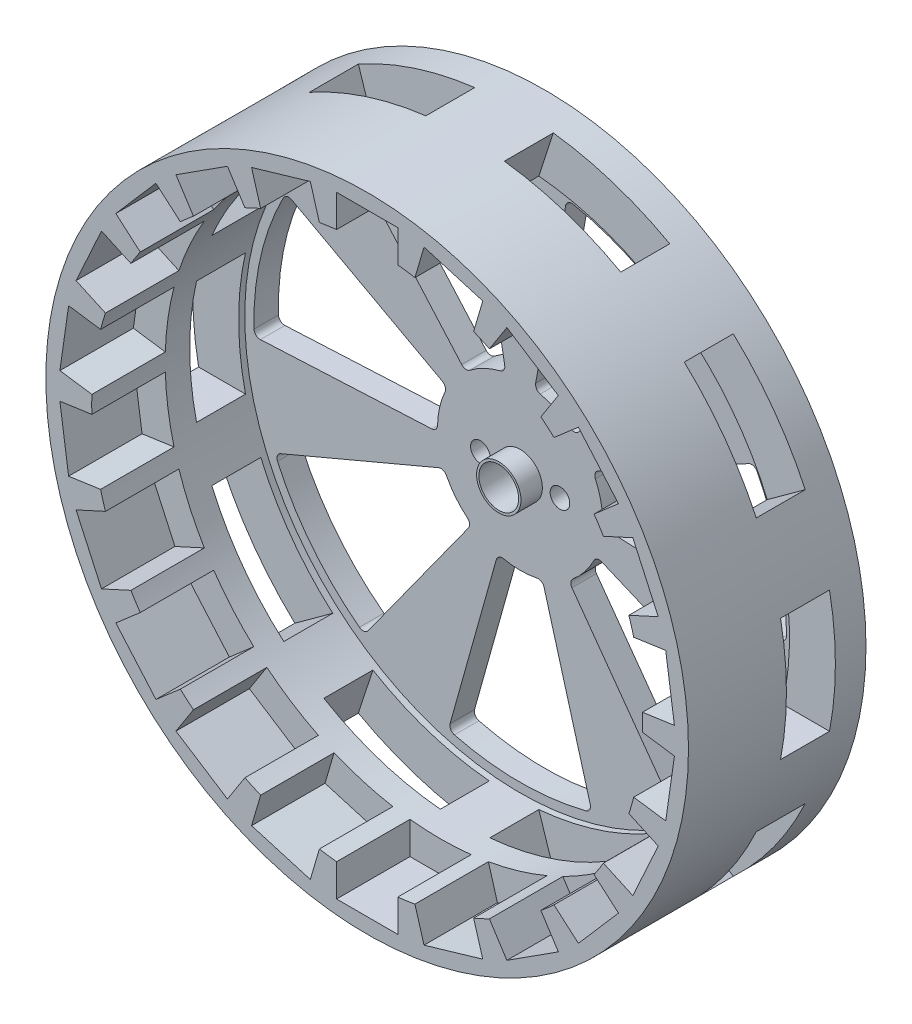
from build123d import *
from build123d.topology import SkipClean

# Parameters (mm, degrees)
SKETCH_1_R                       = 52.5
SKETCH_1_R_2                     = 45
EXTRUDE_1_DEPTH                  = 25
EXTRUDE_START                    = -4
SKETCH_1_2_R                     = 52.5
EXTRUDE_2_DEPTH                  = 4
SKETCH_2_R                       = 3.25
SKETCH_2_R_2                     = 1.6
CUT_EXTRUDE_1_DEPTH              = 4
SKETCH_3_R                       = 3.625
SKETCH_3_R_2                     = 3.25
EXTRUDE_3_DEPTH                  = 3.5
SKETCH_5_W                       = 10
SKETCH_5_H                       = 10
CUT_EXTRUDE_4_DEPTH              = 12
PATTERN_CIRCULAR_2_COUNT         = 22
SKETCH_7_W                       = 8
SKETCH_7_H                       = 20
CUT_EXTRUDE_5_DEPTH              = 10
PATTERN_CIRCULAR_3_COUNT         = 10
CUT_EXTRUDE_6_DEPTH              = 10
FILLET_1_R                       = 1
PATTERN_CIRCULAR_4_COUNT         = 7
FILLET_1_OF_PATTERN_CIRCULAR_4_R = 1


with BuildPart() as part:
    # ｽｹｯﾁ1 → ﾎﾞｽ - 押し出し1 (new body)
    with BuildSketch(Plane.XY):
        Circle(SKETCH_1_R)
        Circle(SKETCH_1_R_2, mode=Mode.SUBTRACT)
    extrude(amount=EXTRUDE_1_DEPTH)

    # ｽｹｯﾁ1<2> → ﾎﾞｽ - 押し出し2 (add)
    with BuildSketch(Plane.XY.offset(EXTRUDE_START)):
        Circle(SKETCH_1_2_R)
    extrude(amount=EXTRUDE_2_DEPTH)

    # ｽｹｯﾁ2 → ｶｯﾄ - 押し出し1 (cut)
    with BuildSketch(Plane(origin=(0, 0, -4), x_dir=(-1, 0, 0), z_dir=(0, 0, -1))):
        Circle(SKETCH_2_R)
        with Locations((6.5, 0)):
            Circle(SKETCH_2_R_2)
        with Locations((-6.5, 0)):
            Circle(SKETCH_2_R_2)
    extrude(amount=-CUT_EXTRUDE_1_DEPTH, mode=Mode.SUBTRACT)

    # ｽｹｯﾁ3 → ﾎﾞｽ - 押し出し3 (add)
    with SkipClean():  # the faces are left unmerged after this step: merging them gives an invalid solid
        with BuildSketch(Plane.XY):
            Circle(SKETCH_3_R)
            Circle(SKETCH_3_R_2, mode=Mode.SUBTRACT)
        extrude(amount=EXTRUDE_3_DEPTH)
    add(part.part.scale(1), mode=Mode.REPLACE)  # the faces are merged on a copy

    # ｽｹｯﾁ5 → ｶｯﾄ - 押し出し4 (cut)
    with BuildSketch(Plane.XY.offset(25)):
        with Locations((0, 45)):
            Rectangle(SKETCH_5_W, SKETCH_5_H)
    cut_extrude_4 = extrude(amount=-CUT_EXTRUDE_4_DEPTH, mode=Mode.SUBTRACT)

    # 円形ﾊﾟﾀｰﾝ2: ｶｯﾄ - 押し出し4 ×22 about axis
    pattern_circular_2_axis = Axis((0, 0, 25), (0, 0, 1))
    for i in range(1, PATTERN_CIRCULAR_2_COUNT):
        add(cut_extrude_4.rotate(pattern_circular_2_axis, i * 360 / PATTERN_CIRCULAR_2_COUNT), mode=Mode.SUBTRACT)

    # ｽｹｯﾁ7 → ｶｯﾄ - 押し出し5 (cut)
    with BuildSketch(Plane(origin=(52.5, 0, 0), x_dir=(0, 0, -1), z_dir=(1, 0, 0))):
        with Locations((-5, 0)):
            Rectangle(SKETCH_7_W, SKETCH_7_H)
    cut_extrude_5 = extrude(amount=-CUT_EXTRUDE_5_DEPTH, mode=Mode.SUBTRACT)

    # 円形ﾊﾟﾀｰﾝ3: ｶｯﾄ - 押し出し5 ×10 about axis
    pattern_circular_3_axis = Axis((0, 0, -4), (0, 0, 1))
    for i in range(1, PATTERN_CIRCULAR_3_COUNT):
        add(cut_extrude_5.rotate(pattern_circular_3_axis, i * 360 / PATTERN_CIRCULAR_3_COUNT), mode=Mode.SUBTRACT)

    # ｽｹｯﾁ4 → ｶｯﾄ - 押し出し6 (cut)
    with BuildSketch(Plane(origin=(0, 0, -4), x_dir=(-1, 0, 0), z_dir=(0, 0, -1))):
        with BuildLine():
            Line((-3.640054945, -13), (-11.729065933, -41.888888889))
            ThreePointArc((-11.729065933, -41.888888889), (0, -43.5), (11.729065933, -41.888888889))
            Line((11.729065933, -41.888888889), (3.640054945, -13))
            ThreePointArc((3.640054945, -13), (0, -13.5), (-3.640054945, -13))
        make_face()
    cut_extrude_6 = extrude(amount=-CUT_EXTRUDE_6_DEPTH, mode=Mode.SUBTRACT)

    # ﾌｨﾚｯﾄ1
    fillet_1_edges = [part.edges().sort_by_distance(p)[0] for p in [
        (-3.640054945, -13, -2),
        (3.640054945, -13, -2),
        (-11.729065933, -41.888888889, -2),
        (11.729065933, -41.888888889, -2),
    ]]
    fillet(fillet_1_edges, radius=FILLET_1_R)

    # 円形ﾊﾟﾀｰﾝ4: ｶｯﾄ - 押し出し6 ×7 about axis
    pattern_circular_4_axis = Axis((0, 0, -4), (0, 0, 1))
    for i in range(1, PATTERN_CIRCULAR_4_COUNT):
        add(cut_extrude_6.rotate(pattern_circular_4_axis, i * 360 / PATTERN_CIRCULAR_4_COUNT), mode=Mode.SUBTRACT)

    # ﾌｨﾚｯﾄ1 of 円形ﾊﾟﾀｰﾝ4
    fillet_1_of_pattern_circular_4_edges = [part.edges().sort_by_distance(p)[0] for p in [
        (7.894272136, -10.951276978, -2),
        (12.433346408, -5.259457871, -2),
        (25.437099105, -35.28744804, -2),
        (40.063005093, -16.947142027, -2),
        (13.484051284, -0.656019026, -2),
        (11.864074432, 6.441563309, -2),
        (43.448609694, -2.113839084, -2),
        (38.228684282, 20.75614844, -2),
        (8.920064791, 10.133234633, -2),
        (2.360912426, 13.291955933, -2),
        (28.742430994, 32.651533817, -2),
        (7.607384484, 42.829635783, -2),
        (-2.360912426, 13.291955933, -2),
        (-8.920064791, 10.133234633, -2),
        (-7.607384484, 42.829635783, -2),
        (-28.742430994, 32.651533817, -2),
        (-11.864074432, 6.441563309, -2),
        (-13.484051284, -0.656019026, -2),
        (-38.228684282, 20.75614844, -2),
        (-43.448609694, -2.113839084, -2),
        (-12.433346408, -5.259457871, -2),
        (-7.894272136, -10.951276978, -2),
        (-40.063005093, -16.947142027, -2),
        (-25.437099105, -35.28744804, -2),
    ]]
    fillet(fillet_1_of_pattern_circular_4_edges, radius=FILLET_1_OF_PATTERN_CIRCULAR_4_R)


solid = part.part
